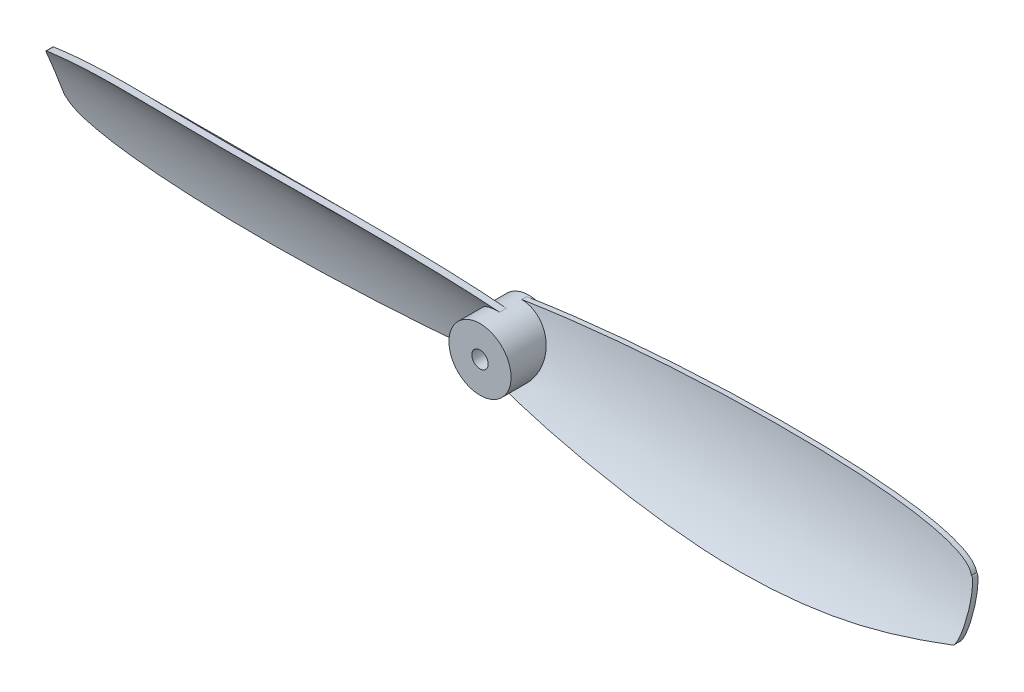
from build123d import *

# Parameters (mm, degrees)
ESBO_O1_R                  = 1.9
RESSALTO_EXTRUS_O1_DEPTH   = 3
RESSALTO_EXTRUS_O3_DEPTH   = 28
CORTE_EXTRUS_O_FINA4_START = -3.000000318
CORTE_EXTRUS_O_FINA4_DEPTH = 3.000000318
PADR_OCIRCULAR1_COUNT      = 2
ESBO_O5_R                  = 0.5
CORTE_EXTRUS_O5_DEPTH      = 2


# Read off the part's stored shape, not the designer's step: Corte-Extrusão-Fina4
with BuildPart() as part:
    # Esboço1 → Ressalto-extrusão1 (new body)
    with BuildSketch(Plane.XY):
        Circle(ESBO_O1_R)
    extrude(amount=RESSALTO_EXTRUS_O1_DEPTH)

    # Esboço4 → Ressalto-extrusão3 (add)
    with BuildSketch(Plane(origin=(0, 0, 0), x_dir=(0, 0, -1), z_dir=(1, 0, 0))):
        with BuildLine():
            Line((0, 2.966582109), (-0.302284292, 2.966582109))
            add(Edge.make_bspline(
                [(-0.302284292, 2.966582109), (-0.48011033, 0.989335618), (-1.388364091, -2.104701367), (-3, -3.303217097)],
                knots=[0, 0, 0, 0, 1, 1, 1, 1], degree=3))
            Line((-3, -3.303217097), (-2.572366731, -3.303217097))
            add(Edge.make_bspline(
                [(0, 2.966582109), (-0.177826038, 0.989335618), (-1.013540392, -2.259955739), (-2.572366731, -3.303217097)],
                knots=[0, 0, 0, 0, 1, 1, 1, 1], degree=3))
        make_face()
    ressalto_extrus_o3 = extrude(amount=RESSALTO_EXTRUS_O3_DEPTH)

    # Corte-Extrusão-Fina4 outline → Corte-Extrusão-Fina4 (cut)
    with BuildSketch(Plane.XY.offset(3).offset(CORTE_EXTRUS_O_FINA4_START)):
        with BuildLine():
            add(Edge.make_bspline(
                [(15.965244027, 2.966582109), (22.160101016, 2.966582102), (27.105451106, 2.406382612), (27.65, 1.185252223)],
                knots=[0.449610583, 0.449610583, 0.449610583, 0.449610583, 1, 1, 1, 1], degree=3))
            add(Edge.make_bspline(
                [(27.65, 1.185252223), (27.943589962, 1.15875623), (28.093651275, -1.845186793), (27.691880485, -1.884412653)],
                knots=[0, 0, 0, 0, 1, 1, 1, 1], degree=3))
            add(Edge.make_bspline(
                [(27.691880485, -1.884412653), (25.053075141, -2.604086837), (21.639173149, -3.168169457), (17.53715106, -3.303217097), (15.849087583, -3.303217097)],
                knots=[0, 0, 0, 0, 0.243203402, 0.407668544, 0.407668544, 0.407668544, 0.407668544], degree=3))
            Line((15.849087583, -3.303217097), (28, -3.303217097))
            Line((28, -3.303217097), (28, 2.966582109))
            Line((28, 2.966582109), (15.965244027, 2.966582109))
        make_face()
        with BuildLine():
            add(Edge.make_bspline(
                [(0, 1.9), (5.010325131, 2.59275087), (10.904693859, 2.966582115), (15.965244027, 2.966582109)],
                knots=[0, 0, 0, 0, 0.449610583, 0.449610583, 0.449610583, 0.449610583], degree=3))
            Line((15.965244027, 2.966582109), (0, 2.966582109))
            Line((0, 2.966582109), (0, 1.9))
        make_face()
        with BuildLine():
            Line((0, -3.303217097), (15.849087583, -3.303217097))
            add(Edge.make_bspline(
                [(15.849087583, -3.303217097), (9.769421811, -3.303217097), (3.259233415, -2.59651639), (0, -1.9)],
                knots=[0.407668544, 0.407668544, 0.407668544, 0.407668544, 1, 1, 1, 1], degree=3))
            Line((0, -1.9), (0, -3.303217097))
        make_face()
    corte_extrus_o_fina4 = extrude(amount=CORTE_EXTRUS_O_FINA4_DEPTH, mode=Mode.SUBTRACT)

    # PadrãoCircular1: Ressalto-extrusão3, Corte-Extrusão-Fina4 ×2 about axis
    padr_ocircular1_axis = Axis((0, 0, 3), (0, 0, -1))
    add([ressalto_extrus_o3.rotate(padr_ocircular1_axis, i * 360 / PADR_OCIRCULAR1_COUNT) for i in range(1, PADR_OCIRCULAR1_COUNT)])
    add([corte_extrus_o_fina4.rotate(padr_ocircular1_axis, i * 360 / PADR_OCIRCULAR1_COUNT) for i in range(1, PADR_OCIRCULAR1_COUNT)], mode=Mode.SUBTRACT)

    # Esboço5 → Corte-extrusão5 (cut)
    with BuildSketch(Plane.XY.offset(3)):
        Circle(ESBO_O5_R)
    extrude(amount=-CORTE_EXTRUS_O5_DEPTH, mode=Mode.SUBTRACT)


solid = part.part
